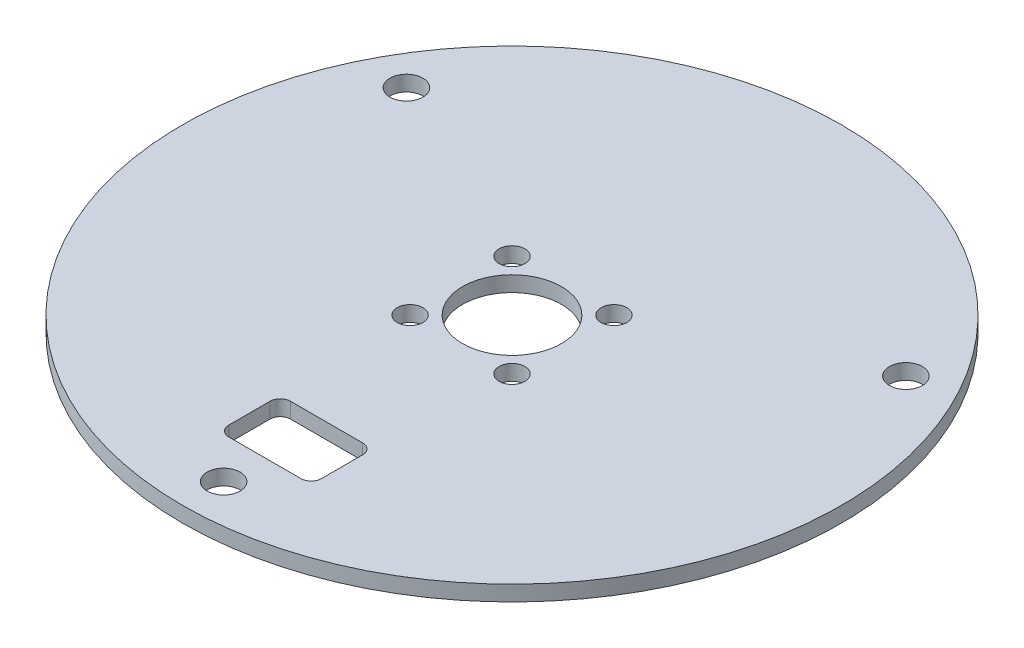
from build123d import *

# Parameters (mm, degrees)
SKETCH1_R          = 32
BASE_FLANGE1_DEPTH = 1.5
SKETCH6_R          = 1.6
CUT_EXTRUDE1_DEPTH = 46.279686395
SKETCH7_R          = 4.8
SKETCH7_R_2        = 1.25
CUT_EXTRUDE2_DEPTH = 46.279686395
SKETCH9_W          = 9
SKETCH9_H          = 6
CUT_EXTRUDE3_DEPTH = 46.279686395
FILLET1_R          = 1


# Sheet-metal steps are written as plain solids
with BuildPart() as part:
    # Sketch1 → Base-Flange1 (new body)
    with BuildSketch(Plane(origin=(0, 0, 0), x_dir=(1, 0, 0), z_dir=(0, 1, 0))):
        with Locations(Location((0, 0, 0), (0, 0, 270))):
            Circle(SKETCH1_R)
    extrude(amount=-BASE_FLANGE1_DEPTH)

    # Sketch6 → Cut-Extrude1 (cut, through all)
    with BuildSketch(Plane(origin=(0, 0, 0), x_dir=(1, 0, 0), z_dir=(0, 1, 0))):
        with Locations(Location((0, -28, 0), (0, 0, 270))):
            Circle(SKETCH6_R)
        with Locations(Location((-24.248711306, 14, 0), (0, 0, 270))):
            Circle(SKETCH6_R)
        with Locations(Location((24.248711306, 14, 0), (0, 0, 270))):
            Circle(SKETCH6_R)
    extrude(amount=-CUT_EXTRUDE1_DEPTH, mode=Mode.SUBTRACT)

    # Sketch7 → Cut-Extrude2 (cut, through all)
    with BuildSketch(Plane(origin=(0, 0, 0), x_dir=(1, 0, 0), z_dir=(0, 1, 0))):
        with Locations(Location((0, 0, 0), (0, 0, 270))):
            Circle(SKETCH7_R)
        with Locations(Location((-4.949747468, 4.949747468, 0), (0, 0, 270))):
            Circle(SKETCH7_R_2)
        with Locations(Location((4.949747468, 4.949747468, 0), (0, 0, 270))):
            Circle(SKETCH7_R_2)
        with Locations(Location((4.949747468, -4.949747468, 0), (0, 0, 270))):
            Circle(SKETCH7_R_2)
        with Locations(Location((-4.949747468, -4.949747468, 0), (0, 0, 270))):
            Circle(SKETCH7_R_2)
    extrude(amount=-CUT_EXTRUDE2_DEPTH, mode=Mode.SUBTRACT)

    # Sketch9 → Cut-Extrude3 (cut, through all)
    with BuildSketch(Plane(origin=(0, 0, 0), x_dir=(1, 0, 0), z_dir=(0, 1, 0))):
        with Locations((0, -21)):
            Rectangle(SKETCH9_W, SKETCH9_H)
    extrude(amount=-CUT_EXTRUDE3_DEPTH, mode=Mode.SUBTRACT)

    # Fillet1
    fillet1_edges = [part.edges().sort_by_distance(p)[0] for p in [
        (-4.5, -0.75, 24),
        (-4.5, -0.75, 18),
        (4.5, -0.75, 18),
        (4.5, -0.75, 24),
    ]]
    fillet(fillet1_edges, radius=FILLET1_R)


solid = part.part
